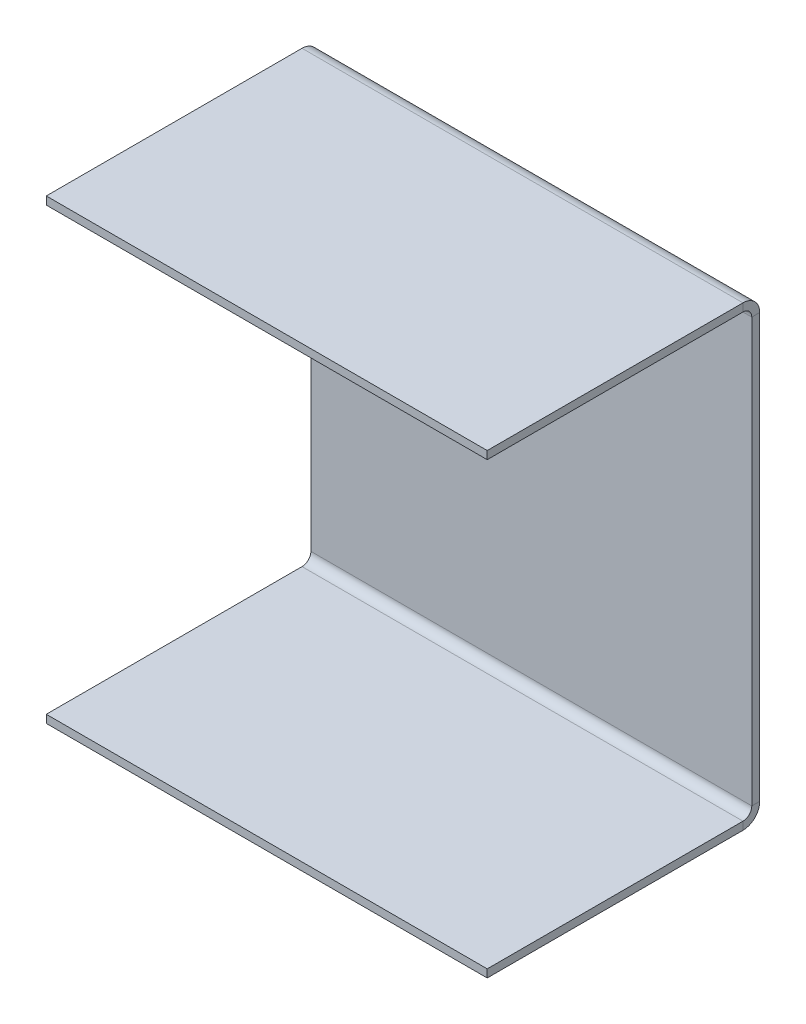
from build123d import *

# Parameters (mm, degrees)
SKETCH1_W                    = 50
SKETCH1_H                    = 50
BASE_FLANGE1_DEPTH           = 0.9
EDGE_FLANGE1_STRIP_W         = 5.6
EDGE_FLANGE1_STRIP_H         = 0.9
EDGE_FLANGE1_STRIP_CUT_DEPTH = 50
EDGE_FLANGE1_DEPTH           = 50
EDGE_FLANGE2_STRIP_W         = 5.6
EDGE_FLANGE2_STRIP_H         = 0.9
EDGE_FLANGE2_STRIP_CUT_DEPTH = 50
EDGE_FLANGE2_DEPTH           = 50


# Sheet-metal steps are written as plain solids
with BuildPart() as part:
    # Sketch1 → Base-Flange1 (new body)
    with BuildSketch(Plane.XY):
        Rectangle(SKETCH1_W, SKETCH1_H)
    extrude(amount=-BASE_FLANGE1_DEPTH)

    # Edge-Flange1 strip (across the edge) → Edge-Flange1 strip cut (cut)
    with BuildSketch(Plane(origin=(25, 25, 0), x_dir=(0, -1, 0), z_dir=(-1, 0, 0))):
        with Locations((-1.8, -0.45)):
            Rectangle(EDGE_FLANGE1_STRIP_W, EDGE_FLANGE1_STRIP_H)
    extrude(amount=EDGE_FLANGE1_STRIP_CUT_DEPTH, mode=Mode.SUBTRACT)

    # Edge-Flange1 section (across the edge) → Edge-Flange1 (add)
    with BuildSketch(Plane(origin=(25, 25, 0), x_dir=(0, -1, 0), z_dir=(-1, 0, 0))):
        with BuildLine():
            Line((-0.9, 1), (-0.9, 30))
            Line((-0.9, 30), (0, 30))
            Line((0, 30), (0, 1))
            ThreePointArc((0, 1), (0.292893219, 0.292893219), (1, 0))
            Line((1, 0), (1, -0.9))
            ThreePointArc((1, -0.9), (-0.343502884, -0.343502884), (-0.9, 1))
        make_face()
    extrude(amount=EDGE_FLANGE1_DEPTH)

    # Edge-Flange2 strip (across the edge) → Edge-Flange2 strip cut (cut)
    with BuildSketch(Plane(origin=(-25, -25, 0), x_dir=(0, 1, 0), z_dir=(1, 0, 0))):
        with Locations((-1.8, -0.45)):
            Rectangle(EDGE_FLANGE2_STRIP_W, EDGE_FLANGE2_STRIP_H)
    extrude(amount=EDGE_FLANGE2_STRIP_CUT_DEPTH, mode=Mode.SUBTRACT)

    # Edge-Flange2 section (across the edge) → Edge-Flange2 (add)
    with BuildSketch(Plane(origin=(-25, -25, 0), x_dir=(0, 1, 0), z_dir=(1, 0, 0))):
        with BuildLine():
            Line((-0.9, 1), (-0.9, 30))
            Line((-0.9, 30), (0, 30))
            Line((0, 30), (0, 1))
            ThreePointArc((0, 1), (0.292893219, 0.292893219), (1, 0))
            Line((1, 0), (1, -0.9))
            ThreePointArc((1, -0.9), (-0.343502884, -0.343502884), (-0.9, 1))
        make_face()
    extrude(amount=EDGE_FLANGE2_DEPTH)


solid = part.part
